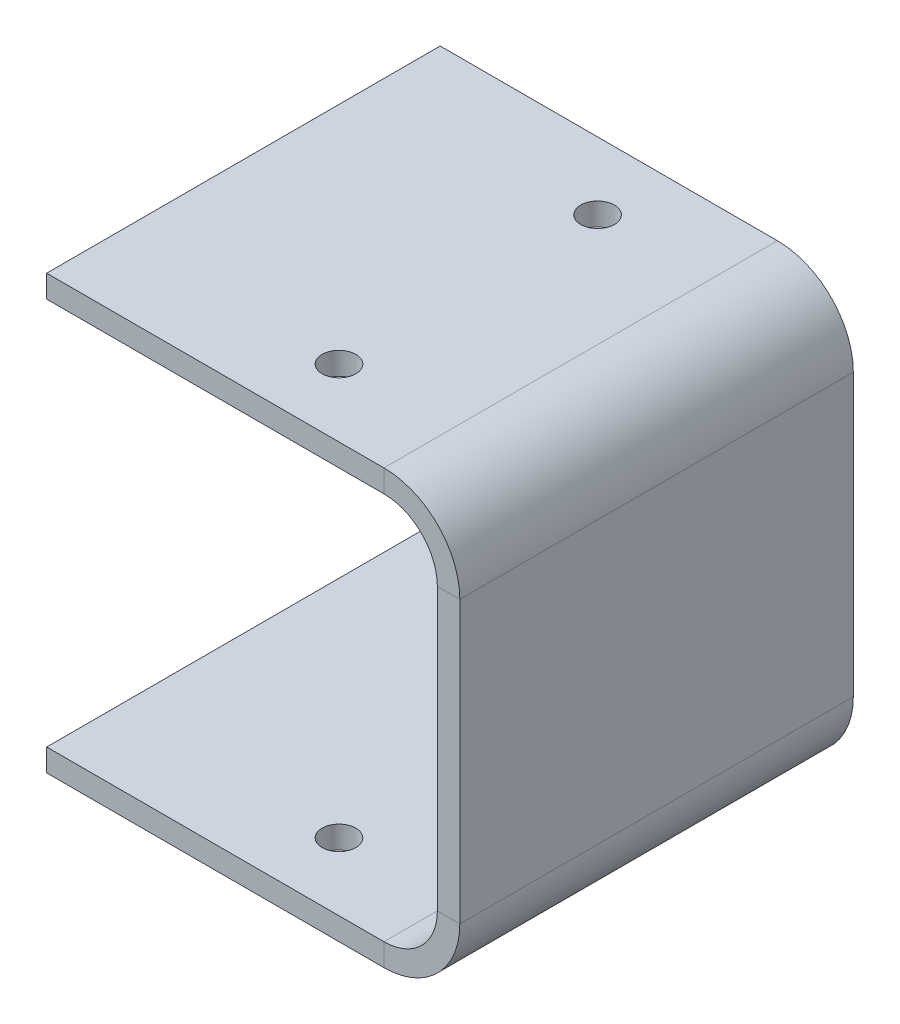
from build123d import *

# Parameters (mm, degrees)
BOSS_EXTRUDE1_DEPTH     = 35
CONVERT_SOLID1_DEPTH    = 35
CUT_EXTRUDE1_DEPTH      = 68.63261331
CUT_EXTRUDE1_DEPTH_BACK = 7.5
SKETCH2_R               = 1.5


# Read off the part's stored shape, not the designer's step: Convert-Solid1
with BuildPart() as part:
    # Sketch1 → Boss-Extrude1 (new body)
    with BuildSketch(Plane.XY):
        with BuildLine():
            Line((0, 0), (30, 0))
            ThreePointArc((30, 0), (34.770067359, 1.975826594), (36.745893953, 6.745893953))
            Line((36.745893953, 6.745893953), (36.745893953, 31.745893953))
            ThreePointArc((36.745893953, 31.745893953), (34.768864726, 36.518864726), (29.995893953, 38.495893953))
            Line((29.995893953, 38.495893953), (-0.004106047, 38.495893953))
            Line((-0.004106047, 38.495893953), (-0.004106047, 36.995893953))
            Line((-0.004106047, 36.995893953), (29.995893953, 36.995893953))
            ThreePointArc((29.995893953, 36.995893953), (33.708204554, 35.458204554), (35.245893953, 31.745893953))
            Line((35.245893953, 31.745893953), (35.245893953, 6.75))
            ThreePointArc((35.245893953, 6.75), (33.708204554, 3.037689399), (29.995893953, 1.5))
            Line((29.995893953, 1.5), (0, 1.5))
            Line((0, 1.5), (0, 0))
        make_face()
    extrude(amount=BOSS_EXTRUDE1_DEPTH)

    # Convert-Solid1 outline → Convert-Solid1 (add)
    with BuildSketch(Plane.XY):
        with BuildLine():
            Line((29.995893953, 36.995893953), (-0.004106047, 36.995893953))
            Line((-0.004106047, 36.995893953), (-0.004106047, 36.495893953))
            Line((-0.004106047, 36.495893953), (29.995893953, 36.495893953))
            ThreePointArc((29.995893953, 36.495893953), (33.354651163, 35.104651163), (34.745893953, 31.745893953))
            Line((34.745893953, 31.745893953), (34.745893953, 6.745893953))
            ThreePointArc((34.745893953, 6.745893953), (33.355853797, 3.390040156), (30, 2))
            Line((30, 2), (0, 2))
            Line((0, 2), (0, 1.5))
            Line((0, 1.5), (29.995893953, 1.5))
            ThreePointArc((29.995893953, 1.5), (33.708204554, 3.037689399), (35.245893953, 6.75))
            Line((35.245893953, 6.75), (35.245893953, 31.745893953))
            ThreePointArc((35.245893953, 31.745893953), (33.708204554, 35.458204554), (29.995893953, 36.995893953))
        make_face()
    extrude(amount=CONVERT_SOLID1_DEPTH)

    # Sketch2 → Cut-Extrude1 (cut, two sides: drawn at the far end of the back side and taken through both)
    with BuildSketch(Plane(origin=(54.180486852, 36.495893953, 17.5), x_dir=(0, 0, 1), z_dir=(0, -1, 0)).offset(-CUT_EXTRUDE1_DEPTH_BACK)):
        with Locations(Location((11.5, 34.184592899, 0), (0, 0, 270))):
            Circle(SKETCH2_R)
        with Locations(Location((-11.5, 34.184592899, 0), (0, 0, 270))):
            Circle(SKETCH2_R)
    extrude(amount=CUT_EXTRUDE1_DEPTH + CUT_EXTRUDE1_DEPTH_BACK, mode=Mode.SUBTRACT)


solid = part.part
